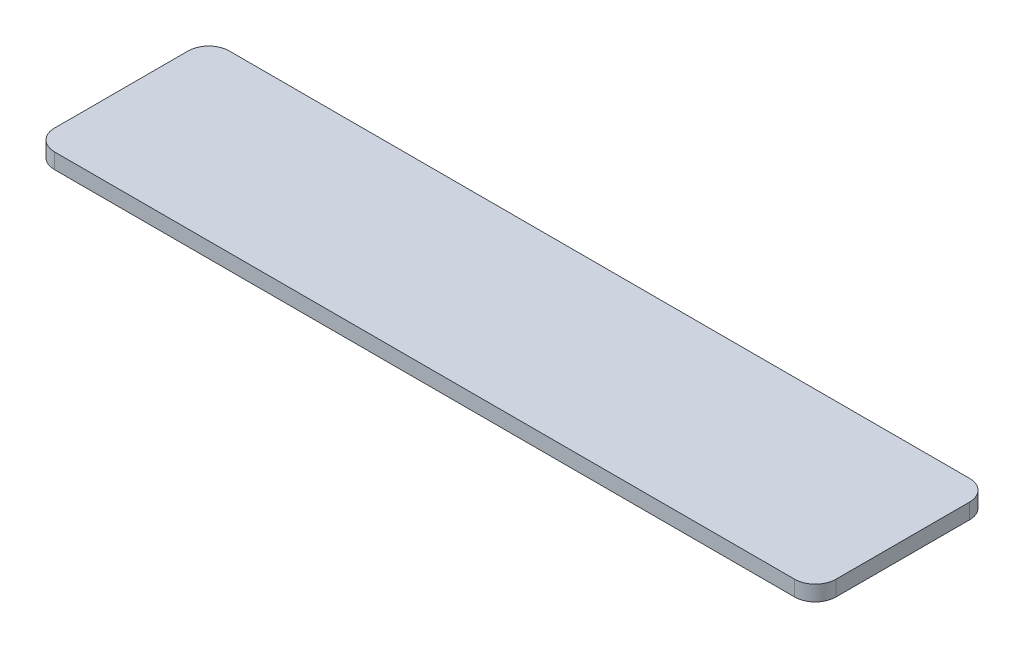
from build123d import *

# Parameters (mm, degrees)
SKETCH1_W          = 482.6
SKETCH1_H          = 107.95
BASE_FLANGE1_DEPTH = 9.525
FILLET1_R          = 12.7


# Sheet-metal steps are written as plain solids
with BuildPart() as part:
    # Sketch1 → Base-Flange1 (new body)
    with BuildSketch(Plane(origin=(0, 0, 0), x_dir=(1, 0, 0), z_dir=(0, 1, 0))):
        Rectangle(SKETCH1_W, SKETCH1_H)
    extrude(amount=-BASE_FLANGE1_DEPTH)

    # Fillet1
    fillet1_edges = [part.edges().sort_by_distance(p)[0] for p in [
        (241.3, -4.7625, 53.975),
        (-241.3, -4.7625, 53.975),
        (-241.3, -4.7625, -53.975),
        (241.3, -4.7625, -53.975),
    ]]
    fillet(fillet1_edges, radius=FILLET1_R)


solid = part.part
